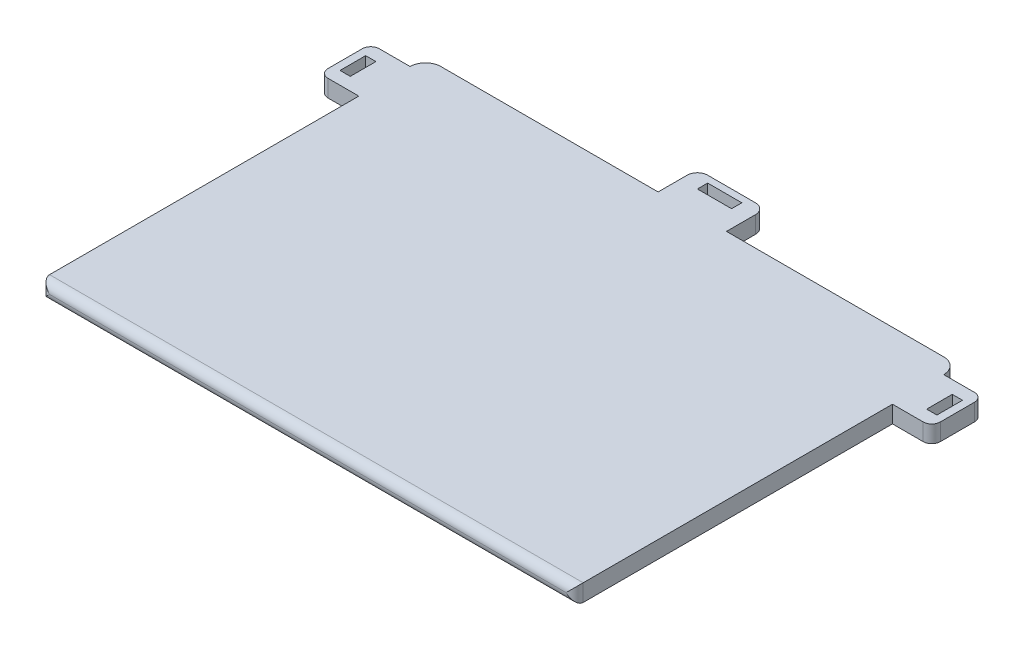
from build123d import *

# Parameters (mm, degrees)
SKETCH1_W            = 793.242
SKETCH1_H            = 571.5
BOSS_EXTRUDE1_DEPTH  = 25.4
FILLET1_R            = 17.78
SKETCH2_W            = 76.2
SKETCH2_H            = 25.4
BOSS_EXTRUDE2_DEPTH  = 58.42
FILLET2_R            = 12.7
SKETCH3_W            = 15.24
SKETCH3_H            = 38.1
CUT_EXTRUDE1_DEPTH   = 538.922423943
FILLET2_OF_MIRROR2_R = 12.7
SKETCH4_W            = 58.42
SKETCH4_H            = 25.4
BOSS_EXTRUDE3_DEPTH  = 50.8
FILLET3_R            = 22.86
FILLET4_R            = 22.86
SKETCH5_W            = 50.8
SKETCH5_H            = 15.24
CUT_EXTRUDE2_DEPTH   = 572.104596883
FILLET7_R            = 15.24
FILLET8_R            = 12.7


with BuildPart() as part:
    # Sketch1 → Boss-Extrude1 (new body)
    with BuildSketch(Plane(origin=(0, 0, 0), x_dir=(1, 0, 0), z_dir=(0, 1, 0))):
        Rectangle(SKETCH1_W, SKETCH1_H)
    boss_extrude1 = extrude(amount=BOSS_EXTRUDE1_DEPTH)

    # Fillet1
    fillet1_edges = [part.edges().sort_by_distance(p)[0] for p in [
        (0, 25.4, 285.75),
        (396.621, 12.7, 285.75),
        (-396.621, 12.7, 285.75),
        (-396.621, 12.7, -285.75),
        (396.621, 12.7, -285.75),
    ]]
    fillet(fillet1_edges, radius=FILLET1_R)

    # Sketch2 → Boss-Extrude2 (add)
    with BuildSketch(Plane.ZY.offset(396.621)):
        with Locations((-224.79, 12.7)):
            Rectangle(SKETCH2_W, SKETCH2_H)
    boss_extrude2 = extrude(amount=BOSS_EXTRUDE2_DEPTH)

    # Fillet2
    fillet2_edges = [part.edges().sort_by_distance(p)[0] for p in [
        (-455.041, 12.7, -262.89),
        (-455.041, 12.7, -186.69),
    ]]
    fillet(fillet2_edges, radius=FILLET2_R)

    # Sketch3 → Cut-Extrude1 (cut, through all)
    with BuildSketch(Plane(origin=(0, 25.4, 0), x_dir=(1, 0, 0), z_dir=(0, 1, 0))):
        with Locations((-435.991, 224.79)):
            Rectangle(SKETCH3_W, SKETCH3_H)
    cut_extrude1 = extrude(amount=-CUT_EXTRUDE1_DEPTH, mode=Mode.SUBTRACT)

    # Mirror2: Boss-Extrude1, Boss-Extrude2, Cut-Extrude1 across plane
    add(boss_extrude1.mirror(Plane(origin=(0, 0, 0), x_dir=(0, 0, 1), z_dir=(1, 0, 0))))
    add(boss_extrude2.mirror(Plane(origin=(0, 0, 0), x_dir=(0, 0, 1), z_dir=(1, 0, 0))))
    add(cut_extrude1.mirror(Plane(origin=(0, 0, 0), x_dir=(0, 0, 1), z_dir=(1, 0, 0))), mode=Mode.SUBTRACT)

    # Fillet2 of Mirror2
    fillet2_of_mirror2_edges = [part.edges().sort_by_distance(p)[0] for p in [
        (455.041, 12.7, -262.89),
        (455.041, 12.7, -186.69),
    ]]
    fillet(fillet2_of_mirror2_edges, radius=FILLET2_OF_MIRROR2_R)

    # Sketch4 → Boss-Extrude3 (add, symmetric)
    with BuildSketch(Plane(origin=(0, 0, 0), x_dir=(0, 0, -1), z_dir=(1, 0, 0))):
        with Locations((314.96, 12.7)):
            Rectangle(SKETCH4_W, SKETCH4_H)
    extrude(amount=BOSS_EXTRUDE3_DEPTH, both=True)

    # Fillet3
    fillet3_edges = [part.edges().sort_by_distance(p)[0] for p in [
        (396.621, 12.7, -285.75),
    ]]
    fillet(fillet3_edges, radius=FILLET3_R - 0.0001)  # a hair under: the kernel refuses the full size

    # Fillet4
    fillet4_edges = [part.edges().sort_by_distance(p)[0] for p in [
        (-396.621, 12.7, -285.75),
    ]]
    fillet(fillet4_edges, radius=FILLET4_R - 0.0001)  # a hair under: the kernel refuses the full size

    # Sketch5 → Cut-Extrude2 (cut, through all)
    with BuildSketch(Plane(origin=(0, 25.4, 0), x_dir=(1, 0, 0), z_dir=(0, 1, 0))):
        with Locations((0, 326.39)):
            Rectangle(SKETCH5_W, SKETCH5_H)
    extrude(amount=-CUT_EXTRUDE2_DEPTH, mode=Mode.SUBTRACT)

    # Fillet7
    fillet7_edges = [part.edges().sort_by_distance(p)[0] for p in [
        (-50.8, 12.7, -344.17),
        (50.8, 12.7, -344.17),
    ]]
    fillet(fillet7_edges, radius=FILLET7_R)

    # Fillet8
    fillet8_edges = [part.edges().sort_by_distance(p)[0] for p in [
        (0, 0, 285.75),
        (0, 25.4, 285.75),
        (-396.621, 12.7, 285.75),
        (396.621, 12.7, 285.75),
    ]]
    fillet(fillet8_edges, radius=FILLET8_R - 0.0001)  # a hair under: the kernel refuses the full size


solid = part.part
